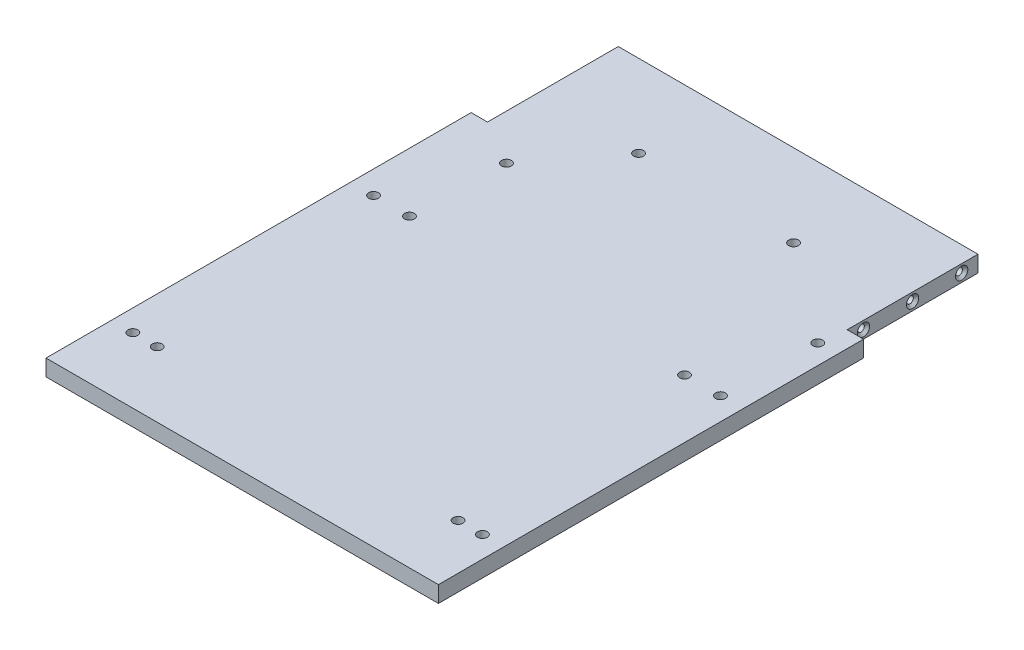
from build123d import *

# Parameters (mm, degrees)
BOSS_EXTRUDE1_DEPTH             = 6.35
F_6_32_TAPPED_HOLE1_D           = 2.7051
F_6_32_TAPPED_HOLE1_DEPTH       = 11.88730597
F_6_32_TAPPED_HOLE1_CSINK_D     = 4.7752
F_6_32_TAPPED_HOLE1_CSINK_ANGLE = 90
F_6_32_TAPPED_HOLE1_TIP         = 0.81269403
F_6_32_TAPPED_HOLE2_D           = 2.7051
F_6_32_TAPPED_HOLE2_DEPTH       = 11.88730597
F_6_32_TAPPED_HOLE2_CSINK_D     = 4.7752
F_6_32_TAPPED_HOLE2_CSINK_ANGLE = 90
F_6_32_TAPPED_HOLE2_TIP         = 0.81269403
SKETCH25_R                      = 1.89865
CUT_EXTRUDE1_DEPTH              = 265.346160366
SKETCH20_R                      = 1.89865
CUT_EXTRUDE2_DEPTH              = 265.346160366
SKETCH16_R                      = 1.89865
CUT_EXTRUDE3_DEPTH              = 265.346160366
SKETCH9_R                       = 1.89865
CUT_EXTRUDE4_DEPTH              = 265.346160366


with BuildPart() as part:
    # Sketch1 → Boss-Extrude1 (new body)
    with BuildSketch(Plane(origin=(0, 0, 0), x_dir=(1, 0, 0), z_dir=(0, 1, 0))):
        Polygon((-6.35, 0), (-6.35, -50.8), (0, -50.8), (0, -215.9), (-152.4, -215.9), (-152.4, -50.8), (-146.05, -50.8), (-146.05, 0), align=None)
    extrude(amount=BOSS_EXTRUDE1_DEPTH)

    # #6-32 Tapped Hole1
    with Locations(Plane(origin=(-6.35, 0, 0), x_dir=(0, 0, -1), z_dir=(1, 0, 0))):
        with Locations((-44.45, 3.175), (-25.4, 3.175), (-6.35, 3.175)):
            CounterSinkHole(F_6_32_TAPPED_HOLE1_D / 2, F_6_32_TAPPED_HOLE1_CSINK_D / 2, depth=F_6_32_TAPPED_HOLE1_DEPTH, counter_sink_angle=F_6_32_TAPPED_HOLE1_CSINK_ANGLE)
            with Locations((0, 0, -(F_6_32_TAPPED_HOLE1_DEPTH + F_6_32_TAPPED_HOLE1_TIP / 2))):  # 118° drill point
                Cone(0, F_6_32_TAPPED_HOLE1_D / 2, F_6_32_TAPPED_HOLE1_TIP, mode=Mode.SUBTRACT)

    # #6-32 Tapped Hole2
    with Locations(Plane.ZY.offset(146.05)):
        with Locations((6.35, 3.175), (25.4, 3.175), (44.45, 3.175)):
            CounterSinkHole(F_6_32_TAPPED_HOLE2_D / 2, F_6_32_TAPPED_HOLE2_CSINK_D / 2, depth=F_6_32_TAPPED_HOLE2_DEPTH, counter_sink_angle=F_6_32_TAPPED_HOLE2_CSINK_ANGLE)
            with Locations((0, 0, -(F_6_32_TAPPED_HOLE2_DEPTH + F_6_32_TAPPED_HOLE2_TIP / 2))):  # 118° drill point
                Cone(0, F_6_32_TAPPED_HOLE2_D / 2, F_6_32_TAPPED_HOLE2_TIP, mode=Mode.SUBTRACT)

    # Sketch25 → Cut-Extrude1 (cut, through all)
    with BuildSketch(Plane(origin=(0, 6.35, 0), x_dir=(1, 0, 0), z_dir=(0, 1, 0))):
        with Locations((-8.32612, -190.5)):
            Circle(SKETCH25_R)
        with Locations((-17.78, -190.5)):
            Circle(SKETCH25_R)
    extrude(amount=-CUT_EXTRUDE1_DEPTH, mode=Mode.SUBTRACT)

    # Sketch20 → Cut-Extrude2 (cut, through all)
    with BuildSketch(Plane(origin=(0, 6.35, 0), x_dir=(1, 0, 0), z_dir=(0, 1, 0))):
        with Locations((-128.524, -60.96)):
            Circle(SKETCH20_R)
        with Locations((-129.54, -97.59811552)):
            Circle(SKETCH20_R)
        with Locations((-143.4846, -97.6122)):
            Circle(SKETCH20_R)
        with Locations((-7.62, -60.96)):
            Circle(SKETCH20_R)
        with Locations((-22.7076, -97.6122)):
            Circle(SKETCH20_R)
        with Locations((-8.763, -97.6122)):
            Circle(SKETCH20_R)
    extrude(amount=-CUT_EXTRUDE2_DEPTH, mode=Mode.SUBTRACT)

    # Sketch16 → Cut-Extrude3 (cut, through all)
    with BuildSketch(Plane(origin=(0, 6.35, 0), x_dir=(1, 0, 0), z_dir=(0, 1, 0))):
        with Locations((-45.974, -32.004)):
            Circle(SKETCH16_R)
        with Locations((-106.172, -32.004)):
            Circle(SKETCH16_R)
    extrude(amount=-CUT_EXTRUDE3_DEPTH, mode=Mode.SUBTRACT)

    # Sketch9 → Cut-Extrude4 (cut, through all)
    with BuildSketch(Plane(origin=(0, 6.35, 0), x_dir=(1, 0, 0), z_dir=(0, 1, 0))):
        with Locations((-134.62, -190.5)):
            Circle(SKETCH9_R)
        with Locations((-144.07388, -190.5)):
            Circle(SKETCH9_R)
    extrude(amount=-CUT_EXTRUDE4_DEPTH, mode=Mode.SUBTRACT)


solid = part.part
